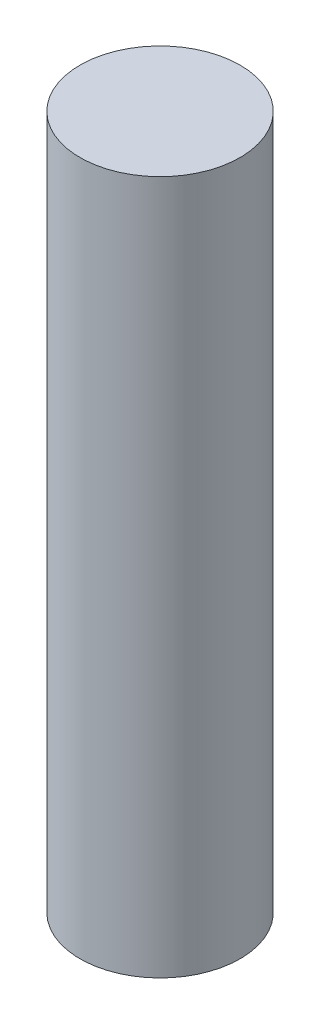
from build123d import *

# Parameters (mm, degrees)
SKETCH1_R           = 3
BOSS_EXTRUDE1_DEPTH = 26


with BuildPart() as part:
    # Sketch1 → Boss-Extrude1 (new body)
    with BuildSketch(Plane(origin=(0, 0, 0), x_dir=(1, 0, 0), z_dir=(0, 1, 0))):
        Circle(SKETCH1_R)
    extrude(amount=BOSS_EXTRUDE1_DEPTH)


solid = part.part
